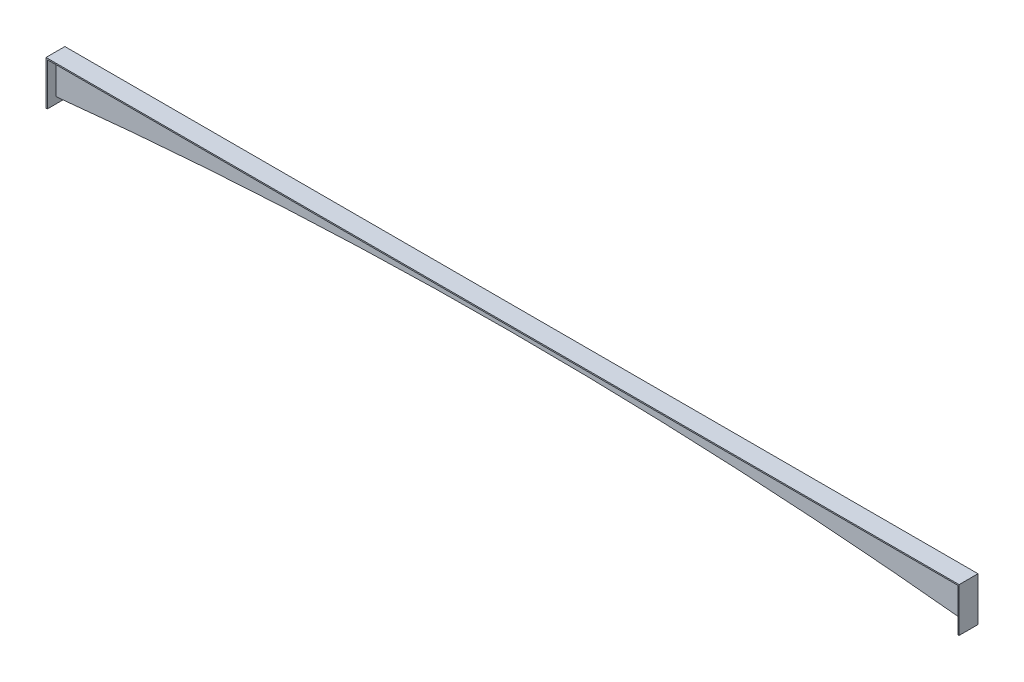
from build123d import *

# Parameters (mm, degrees)
BOSS_EXTRUDE1_DEPTH = 19.05
RIB1_START          = -1.27
RIB1_DEPTH          = 2.54


# Read off the part's stored shape, not the designer's step: Rib1
with BuildPart() as part:
    # Sketch1 → Boss-Extrude1 (new, symmetric)
    with BuildSketch(Plane.XY):
        Polygon((-921.54375, 88.9), (921.54375, 88.9), (921.54375, 0), (919.00375, 0), (919.00375, 86.36), (-919.00375, 86.36), (-919.00375, 0), (-921.54375, 0), align=None)
    extrude(amount=BOSS_EXTRUDE1_DEPTH, both=True)

    # Rib1 outline → Rib1 (add)
    with BuildSketch(Plane.XY.offset(RIB1_START)):
        with BuildLine():
            Line((-919.00375, 86.36), (-919.00375, 12.7))
            ThreePointArc((-919.00375, 12.7), (0, 60.96), (919.00375, 12.7))
            Line((919.00375, 12.7), (919.00375, 86.36))
            Line((919.00375, 86.36), (-919.00375, 86.36))
        make_face()
    extrude(amount=RIB1_DEPTH)


solid = part.part
